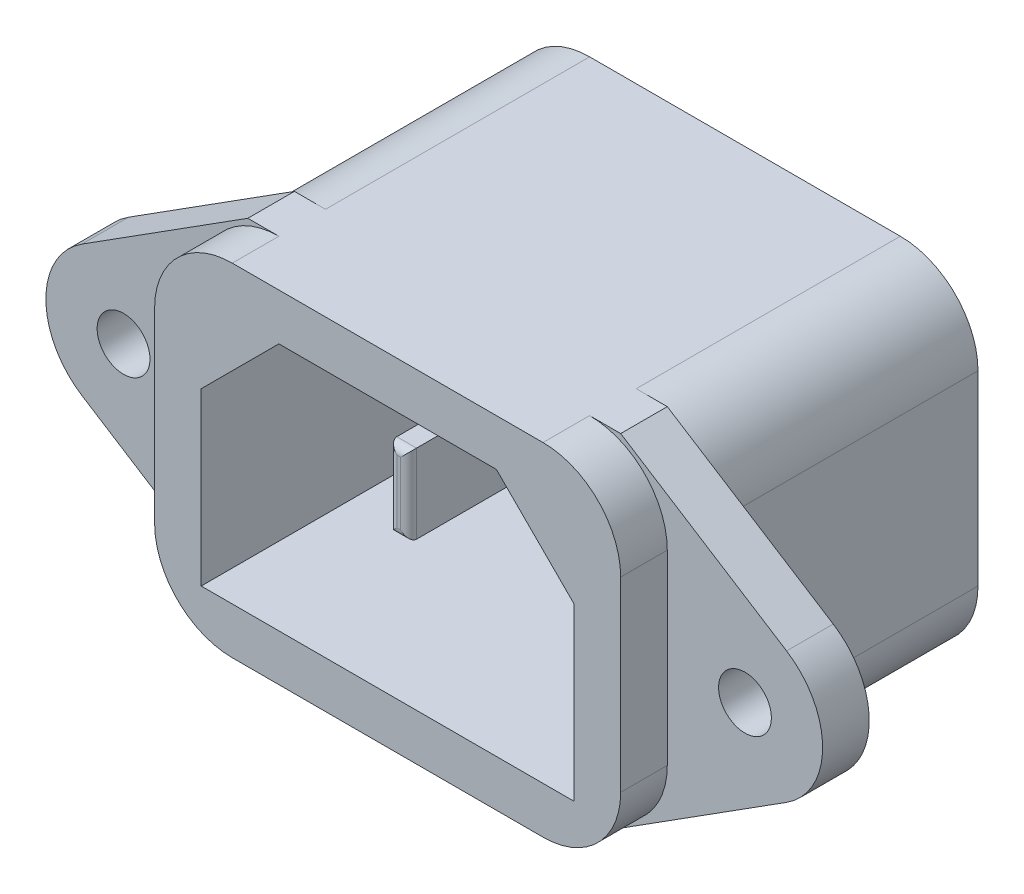
from build123d import *

# Parameters (mm, degrees)
BOSS_EXTRUDE1_DEPTH      = 3
SKETCH2_R                = 1.7
CUT_EXTRUDE1_DEPTH       = 3
BOSS_EXTRUDE2_DEPTH      = 3
BOSS_EXTRUDE2_DEPTH_BACK = 20
CUT_EXTRUDE2_DEPTH       = 17
SKETCH6_W                = 1.27
SKETCH6_H                = 5.08
BOSS_EXTRUDE3_DEPTH      = 10
FILLET1_R                = 0.508


with BuildPart() as part:
    # Sketch1 → Boss-Extrude1 (new body)
    with BuildSketch(Plane.XY):
        with BuildLine():
            Line((24, 22), (34.679465326, 15.221429328))
            ThreePointArc((34.679465326, 15.221429328), (37, 11), (34.679465326, 6.778570672))
            Line((34.679465326, 6.778570672), (24, 0))
            Line((24, 0), (0, 0))
            Line((0, 0), (-10.679465326, 6.778570672))
            ThreePointArc((-10.679465326, 6.778570672), (-13, 11), (-10.679465326, 15.221429328))
            Line((-10.679465326, 15.221429328), (0, 22))
            Line((0, 22), (24, 22))
        make_face()
    extrude(amount=BOSS_EXTRUDE1_DEPTH)

    # Sketch2 → Cut-Extrude1 (cut)
    with BuildSketch(Plane.XY.offset(3)):
        with Locations((32, 11)):
            Circle(SKETCH2_R)
        with Locations((-8, 11)):
            Circle(SKETCH2_R)
    extrude(amount=-CUT_EXTRUDE1_DEPTH, mode=Mode.SUBTRACT)

    # Sketch3 → Boss-Extrude2 (add, two sides: drawn at the far end of the back side and taken through both)
    with BuildSketch(Plane.XY.offset(3).offset(-BOSS_EXTRUDE2_DEPTH_BACK)):
        with BuildLine():
            Line((2, 22), (22, 22))
            ThreePointArc((22, 22), (25.535533906, 20.535533906), (27, 17))
            Line((27, 17), (27, 5))
            ThreePointArc((27, 5), (25.535533906, 1.464466094), (22, 0))
            Line((22, 0), (2, 0))
            ThreePointArc((2, 0), (-1.535533906, 1.464466094), (-3, 5))
            Line((-3, 5), (-3, 17))
            ThreePointArc((-3, 17), (-1.535533906, 20.535533906), (2, 22))
        make_face()
    extrude(amount=BOSS_EXTRUDE2_DEPTH + BOSS_EXTRUDE2_DEPTH_BACK)

    # Sketch5 → Cut-Extrude2 (cut)
    with BuildSketch(Plane.XY.offset(6)):
        Polygon((5, 19), (19, 19), (24, 14), (24, 3), (0, 3), (0, 14), align=None)
    extrude(amount=-CUT_EXTRUDE2_DEPTH, mode=Mode.SUBTRACT)

    # Sketch6 → Boss-Extrude3 (add)
    with BuildSketch(Plane.XY.offset(-11)):
        with Locations((12.058361068, 15.19)):
            Rectangle(SKETCH6_W, SKETCH6_H)
        with Locations((18.285, 7.57)):
            Rectangle(SKETCH6_W, SKETCH6_H)
        with Locations((5.715, 7.57)):
            Rectangle(SKETCH6_W, SKETCH6_H)
    extrude(amount=BOSS_EXTRUDE3_DEPTH)

    # Fillet1
    fillet1_edges = [part.edges().sort_by_distance(p)[0] for p in [
        (12.058361068, 17.73, -1),
        (12.058361068, 12.65, -1),
        (5.715, 5.03, -1),
        (5.715, 10.11, -1),
        (5.08, 7.57, -1),
        (6.35, 7.57, -1),
        (18.285, 5.03, -1),
        (18.285, 10.11, -1),
        (17.65, 7.57, -1),
        (18.92, 7.57, -1),
        (11.423361068, 15.19, -1),
        (12.693361068, 15.19, -1),
    ]]
    fillet(fillet1_edges, radius=FILLET1_R)


solid = part.part
